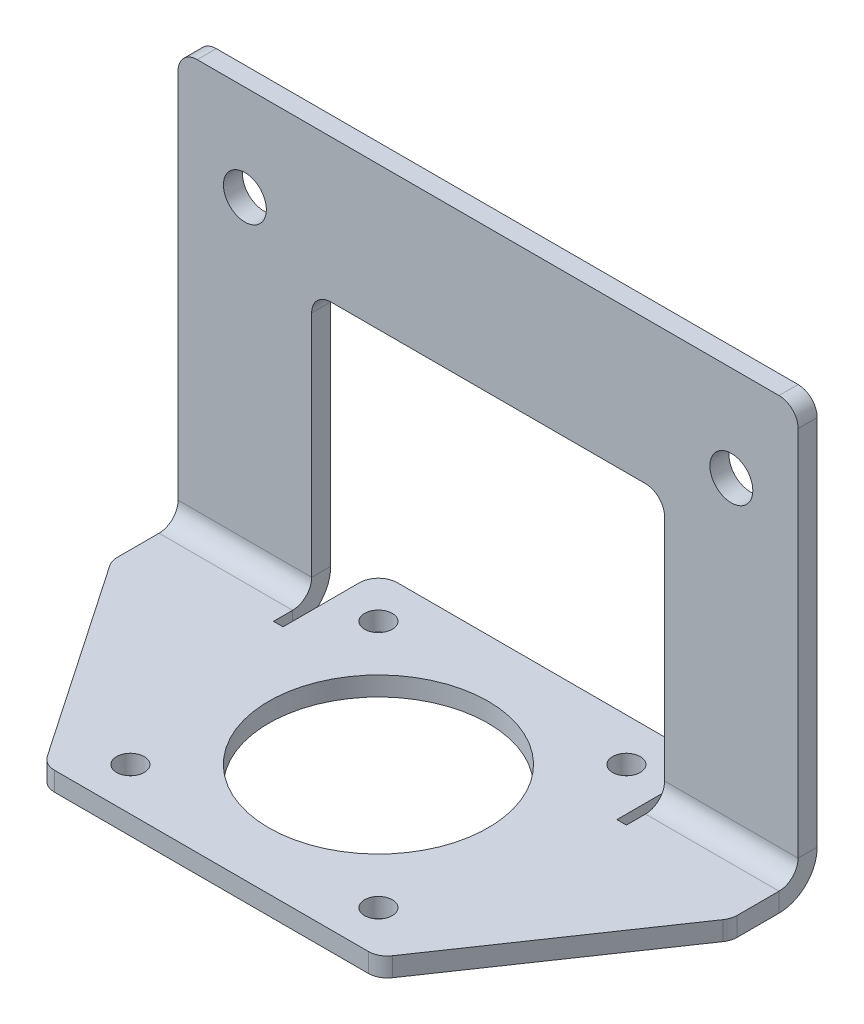
from build123d import *

# Parameters (mm, degrees)
BASE_FLANGE1_DEPTH         = 2
EDGE_FLANGE1_DEPTH         = 14
FILLET1_R                  = 2
SKETCH9_W                  = 37
SKETCH9_H                  = 15
BOSS_EXTRUDE1_DEPTH        = 2
FILLET2_R                  = 2
CUT_EXTRUDE1_DEPTH         = 2
FILLET3_R                  = 2
M2_5_CLEARANCE_HOLE1_D     = 2.9
M2_5_CLEARANCE_HOLE1_DEPTH = 2
M4_CLEARANCE_HOLE1_D       = 4.5
SKETCH15_R                 = 11.5
CUT_EXTRUDE2_DEPTH         = 10


# Sheet-metal steps are written as plain solids
with BuildPart() as part:
    # Sketch1 → Base-Flange1 (new body)
    with BuildSketch(Plane(origin=(0, 0, 0), x_dir=(1, 0, 0), z_dir=(0, 1, 0))):
        Polygon((-17.5, -17.5), (-32.5, -17.5), (-32.5, 9.5), (-18.5, 9.5), (-18.5, 7.5), (-17.5, 7.5), (-17.5, 8.5), (-17.5, 17.5), (17.5, 17.5), (17.5, 8.5), (17.5, 7.5), (18.5, 7.5), (18.5, 9.5), (32.5, 9.5), (32.5, -17.5), (17.5, -17.5), align=None)
    extrude(amount=-BASE_FLANGE1_DEPTH)

    # Edge-Flange1 section (across the edge) → Edge-Flange1 (add)
    with BuildSketch(Plane(origin=(-18.5, 0, -11.5), x_dir=(0, 0, 1), z_dir=(-1, 0, 0))):
        with BuildLine():
            Line((-2, 2), (-2, 43))
            Line((-2, 43), (0, 43))
            Line((0, 43), (0, 2))
            ThreePointArc((0, 2), (0.585786438, 0.585786438), (2, 0))
            Line((2, 0), (2, -2))
            ThreePointArc((2, -2), (-0.828427125, -0.828427125), (-2, 2))
        make_face()
    edge_flange1 = extrude(amount=EDGE_FLANGE1_DEPTH)

    # Mirror1: Edge-Flange1 across plane
    add(edge_flange1.mirror(Plane(origin=(0, 0, 0), x_dir=(0, 0, 1), z_dir=(1, 0, 0))))

    # Fillet1
    fillet1_edges = [part.edges().sort_by_distance(p)[0] for p in [
        (-17.5, -1, -17.5),
        (17.5, -1, -17.5),
    ]]
    fillet(fillet1_edges, radius=FILLET1_R)

    # Sketch9 → Boss-Extrude1 (add)
    with BuildSketch(Plane.XY.offset(-11.5)):
        with Locations((0, 35.5)):
            Rectangle(SKETCH9_W, SKETCH9_H)
    extrude(amount=-BOSS_EXTRUDE1_DEPTH)

    # Fillet2
    fillet2_edges = [part.edges().sort_by_distance(p)[0] for p in [
        (-18.5, 28, -12.5),
        (18.5, 28, -12.5),
        (-32.5, 43, -12.5),
        (32.5, 43, -12.5),
    ]]
    fillet(fillet2_edges, radius=FILLET2_R)

    # Sketch10 → Cut-Extrude1 (cut)
    with BuildSketch(Plane(origin=(0, 0, 0), x_dir=(1, 0, 0), z_dir=(0, 1, 0))):
        Polygon((-32.5, 4.5), (-17.5, -17.5), (-32.5, -17.5), align=None)
    cut_extrude1 = extrude(amount=-CUT_EXTRUDE1_DEPTH, mode=Mode.SUBTRACT)

    # Mirror2: Cut-Extrude1 across plane
    add(cut_extrude1.mirror(Plane(origin=(0, 0, 0), x_dir=(0, 0, 1), z_dir=(1, 0, 0))), mode=Mode.SUBTRACT)

    # Fillet3
    fillet3_edges = [part.edges().sort_by_distance(p)[0] for p in [
        (-32.5, -1, -4.5),
        (-17.5, -1, 17.5),
        (32.5, -1, -4.5),
        (17.5, -1, 17.5),
    ]]
    fillet(fillet3_edges, radius=FILLET3_R)

    # M2.5 Clearance Hole1
    with Locations(Plane(origin=(0, 0, 0), x_dir=(1, 0, 0), z_dir=(0, 1, 0))):
        with Locations((13, -13), (-13, -13), (-13, 13), (13, 13)):
            Hole(M2_5_CLEARANCE_HOLE1_D / 2, depth=M2_5_CLEARANCE_HOLE1_DEPTH)

    # M4 Clearance Hole1 (through all)
    with Locations(Plane.XY.offset(-11.5)):
        with Locations((-25.5, 33), (25.5, 33)):
            Hole(M4_CLEARANCE_HOLE1_D / 2)

    # Sketch15 → Cut-Extrude2 (cut)
    with BuildSketch(Plane(origin=(0, 0, 0), x_dir=(1, 0, 0), z_dir=(0, 1, 0))):
        with Locations(Location((0, 0, 0), (0, 0, 270))):
            Circle(SKETCH15_R)
    extrude(amount=-CUT_EXTRUDE2_DEPTH, mode=Mode.SUBTRACT)


solid = part.part
